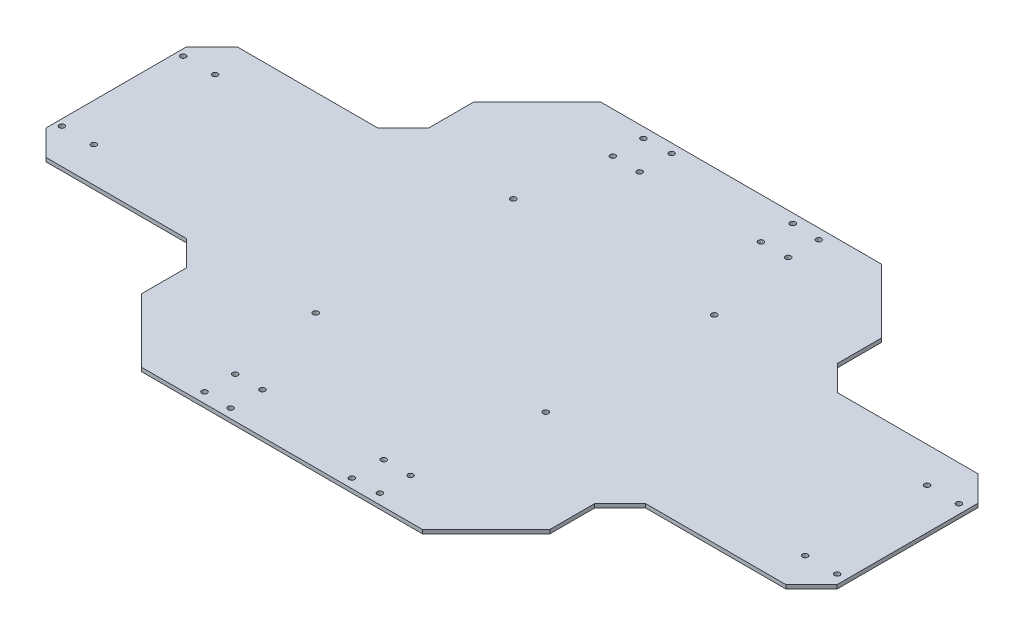
from build123d import *

# Parameters (mm, degrees)
EXTRUDE_1_DEPTH     = 3
CHAMFER_1_SIZE      = 20
SKETCH_2_W          = 320
SKETCH_2_H          = 20
CUT_EXTRUDE_1_DEPTH = 5
CHAMFER_2_SIZE      = 50
SKETCH_3_R          = 2.1
CUT_EXTRUDE_2_DEPTH = 80
SKETCH_4_R          = 2.15
CUT_EXTRUDE_3_DEPTH = 10


with BuildPart() as part:
    # 草图1 → 凸台-拉伸1 (new body)
    with BuildSketch(Plane(origin=(0, 0, 0), x_dir=(1, 0, 0), z_dir=(0, 1, 0))):
        Polygon((-310, -75), (-160, -75), (-160, -200), (160, -200), (160, -75), (310, -75), (310, 75.500128132), (160, 75.500128132), (160, 200), (-160, 200), (-160, 75), (-310, 75), align=None)
    extrude(amount=EXTRUDE_1_DEPTH)

    # 倒角1
    chamfer_1_edges = [part.edges().sort_by_distance(p)[0] for p in [
        (-160, 1.5, -75),
        (-310, 1.5, -75),
        (-310, 1.5, 75),
        (-160, 1.5, 75),
        (160, 1.5, 75),
        (160, 1.5, -75.500128132),
        (310, 1.5, 75),
        (310, 1.5, -75.500128132),
    ]]
    chamfer(chamfer_1_edges, length=CHAMFER_1_SIZE)

    # 草图2 → 切除-拉伸1 (cut)
    with BuildSketch(Plane(origin=(0, 3, 0), x_dir=(1, 0, 0), z_dir=(0, 1, 0))):
        with Locations((0, 190)):
            Rectangle(SKETCH_2_W, SKETCH_2_H)
        with Locations((0, -190)):
            Rectangle(SKETCH_2_W, SKETCH_2_H)
    extrude(amount=-CUT_EXTRUDE_1_DEPTH, mode=Mode.SUBTRACT)

    # 倒角2
    chamfer_2_edges = [part.edges().sort_by_distance(p)[0] for p in [
        (-160, 1.5, -180),
        (-160, 1.5, 180),
        (160, 1.5, -180),
        (160, 1.5, 180),
    ]]
    chamfer(chamfer_2_edges, length=CHAMFER_2_SIZE)

    # 草图3 → 切除-拉伸2 (cut)
    with BuildSketch(Plane(origin=(0, 3, 0), x_dir=(1, 0, 0), z_dir=(0, 1, 0))):
        with Locations((-305, 47.5)):
            Circle(SKETCH_3_R)
        with Locations((-280, 47.5)):
            Circle(SKETCH_3_R)
        with Locations((-47.5, 172.826293853)):
            Circle(SKETCH_3_R)
        with Locations((-47.5, 147.826293853)):
            Circle(SKETCH_3_R)
        with Locations((47.5, 172.826293853)):
            Circle(SKETCH_3_R)
        with Locations((47.5, 147.826293853)):
            Circle(SKETCH_3_R)
        with Locations((277.826293853, 47.750064066)):
            Circle(SKETCH_3_R)
        with Locations((302.826293853, 47.750064066)):
            Circle(SKETCH_3_R)
        with Locations((-68.75, 172)):
            Circle(SKETCH_3_R)
        with Locations((-68.75, 148)):
            Circle(SKETCH_3_R)
        with Locations((68.75, 172)):
            Circle(SKETCH_3_R)
        with Locations((68.75, 148)):
            Circle(SKETCH_3_R)
        with Locations((68.75, -148)):
            Circle(SKETCH_3_R)
        with Locations((68.75, -172)):
            Circle(SKETCH_3_R)
        with Locations((-68.75, -148)):
            Circle(SKETCH_3_R)
        with Locations((-68.75, -172)):
            Circle(SKETCH_3_R)
        with Locations((302.826293853, -47.750064066)):
            Circle(SKETCH_3_R)
        with Locations((277.826293853, -47.750064066)):
            Circle(SKETCH_3_R)
        with Locations((47.5, -147.826293853)):
            Circle(SKETCH_3_R)
        with Locations((47.5, -172.826293853)):
            Circle(SKETCH_3_R)
        with Locations((-47.5, -147.826293853)):
            Circle(SKETCH_3_R)
        with Locations((-47.5, -172.826293853)):
            Circle(SKETCH_3_R)
        with Locations((-280, -47.5)):
            Circle(SKETCH_3_R)
        with Locations((-305, -47.5)):
            Circle(SKETCH_3_R)
    extrude(amount=-CUT_EXTRUDE_2_DEPTH, mode=Mode.SUBTRACT)

    # 草图4 → 切除-拉伸3 (cut)
    with BuildSketch(Plane.XZ):
        with Locations((-78.739999994, 74.909999989)):
            Circle(SKETCH_4_R)
        with Locations((-78.739999994, -80.01)):
            Circle(SKETCH_4_R)
        with Locations((78.740000006, -80.01)):
            Circle(SKETCH_4_R)
        with Locations((78.740000006, 52.07)):
            Circle(SKETCH_4_R)
    extrude(amount=-CUT_EXTRUDE_3_DEPTH, mode=Mode.SUBTRACT)


solid = part.part
